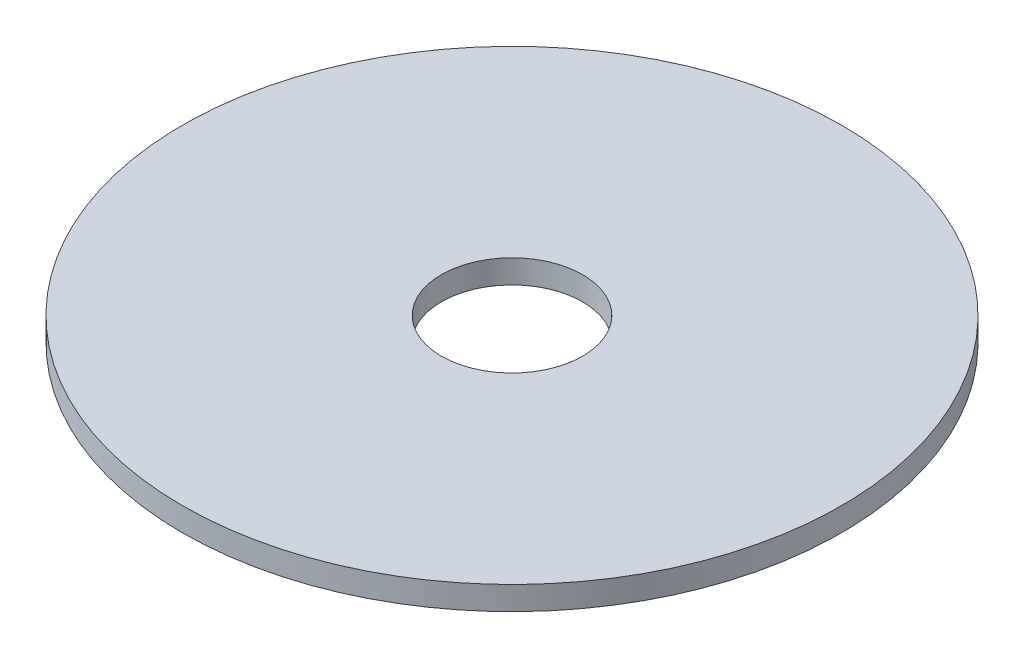
from build123d import *

# Parameters (mm, degrees)
SKETCH1_R           = 70
BOSS_EXTRUDE1_DEPTH = 5
SKETCH2_R           = 15
CUT_EXTRUDE1_DEPTH  = 100.121138008


with BuildPart() as part:
    # Sketch1 → Boss-Extrude1 (new body)
    with BuildSketch(Plane(origin=(0, 0, 0), x_dir=(1, 0, 0), z_dir=(0, 1, 0))):
        Circle(SKETCH1_R)
    extrude(amount=BOSS_EXTRUDE1_DEPTH)

    # Sketch2 → Cut-Extrude1 (cut, through all)
    with BuildSketch(Plane(origin=(0, 0, 0), x_dir=(1, 0, 0), z_dir=(0, 1, 0))):
        Circle(SKETCH2_R)
    extrude(amount=CUT_EXTRUDE1_DEPTH, mode=Mode.SUBTRACT)


solid = part.part
